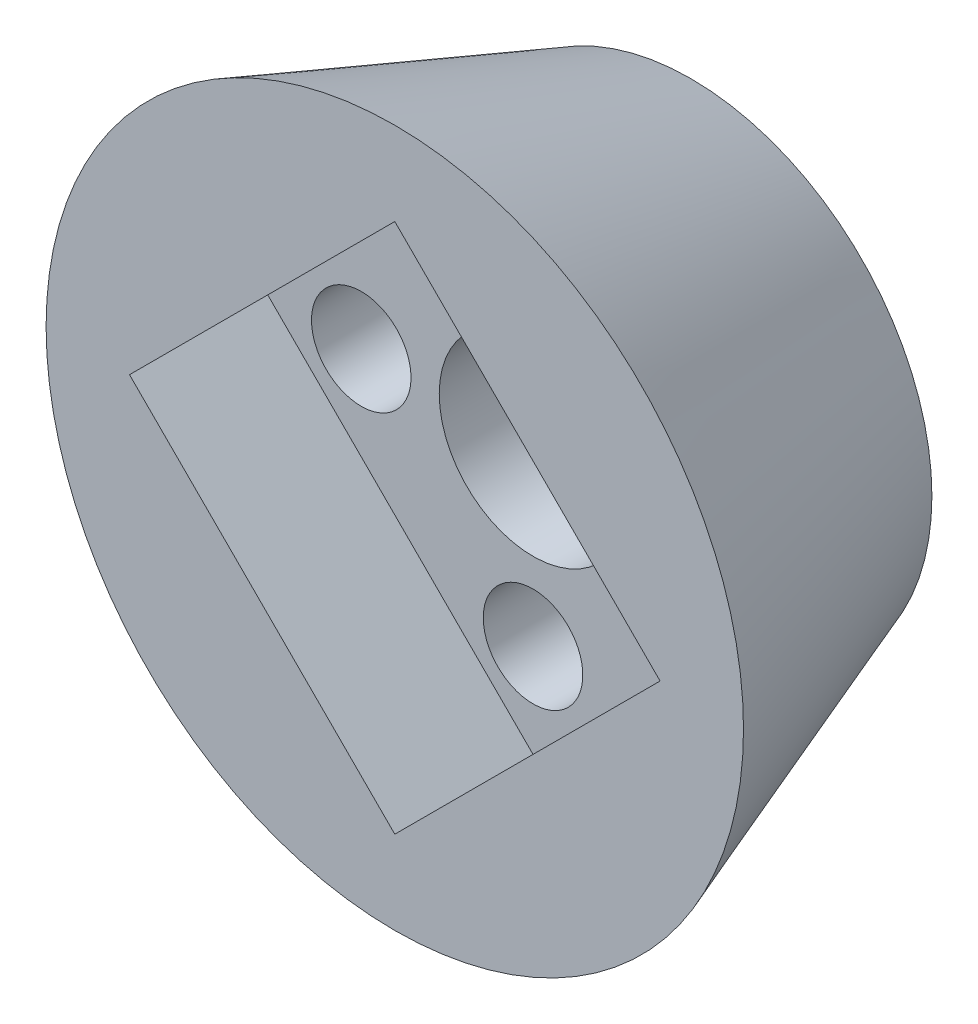
from build123d import *

# Parameters (mm, degrees)
GEARFACEPROFILE_R           = 12.2
GEARFACEEXTRUDE_DEPTH       = 15
GEARFACEEXTRUDE_DRAFT       = -20
CENTERHOLEPROFILE_R         = 4.75
CENTERHOLECUT_DEPTH         = 30.13279356
SCREWHOLEPROFILE_R          = 2.52
SCREWHOLECUT_DEPTH          = 30.13279356
SHAFTCOLLARDOCKINGCUT_DEPTH = 7


with BuildPart() as part:
    # GearFaceProfile → GearFaceExtrude (with draft: the straight prism first)
    with BuildSketch(Plane.XY):
        Circle(GEARFACEPROFILE_R)
    extrude(amount=GEARFACEEXTRUDE_DEPTH)
    # GearFaceExtrude: the draft: its side faces are tilted about the plane it starts from
    gearfaceextrude_sides = [part.faces().sort_by_distance(p)[0] for p in [
        (-12.2, 0, 7.5),
    ]]
    draft(gearfaceextrude_sides, Plane.XY, GEARFACEEXTRUDE_DRAFT)

    # CenterHoleProfile → CenterHoleCut (cut, through all)
    with BuildSketch(Plane(origin=(0, 0, 0), x_dir=(-1, 0, 0), z_dir=(0, 0, -1))):
        Circle(CENTERHOLEPROFILE_R)
    extrude(amount=-CENTERHOLECUT_DEPTH, mode=Mode.SUBTRACT)

    # ScrewHoleProfile → ScrewHoleCut (cut, through all)
    with BuildSketch(Plane(origin=(0, 0, 0), x_dir=(-1, 0, 0), z_dir=(0, 0, -1))):
        with Locations((0, 8.7)):
            Circle(SCREWHOLEPROFILE_R)
        with Locations((8.7, 0)):
            Circle(SCREWHOLEPROFILE_R)
        with Locations((0, -8.7)):
            Circle(SCREWHOLEPROFILE_R)
        with Locations((-8.7, 0)):
            Circle(SCREWHOLEPROFILE_R)
    extrude(amount=-SCREWHOLECUT_DEPTH, mode=Mode.SUBTRACT)

    # ShaftCollarAttachmentProfile → ShaftCollarDockingCut (cut)
    with BuildSketch(Plane.XY.offset(15)):
        Polygon((0, 13.435028843), (13.435028843, 0), (0, -13.435028843), (-13.435028843, 0), align=None)
    extrude(amount=-SHAFTCOLLARDOCKINGCUT_DEPTH, mode=Mode.SUBTRACT)


solid = part.part
